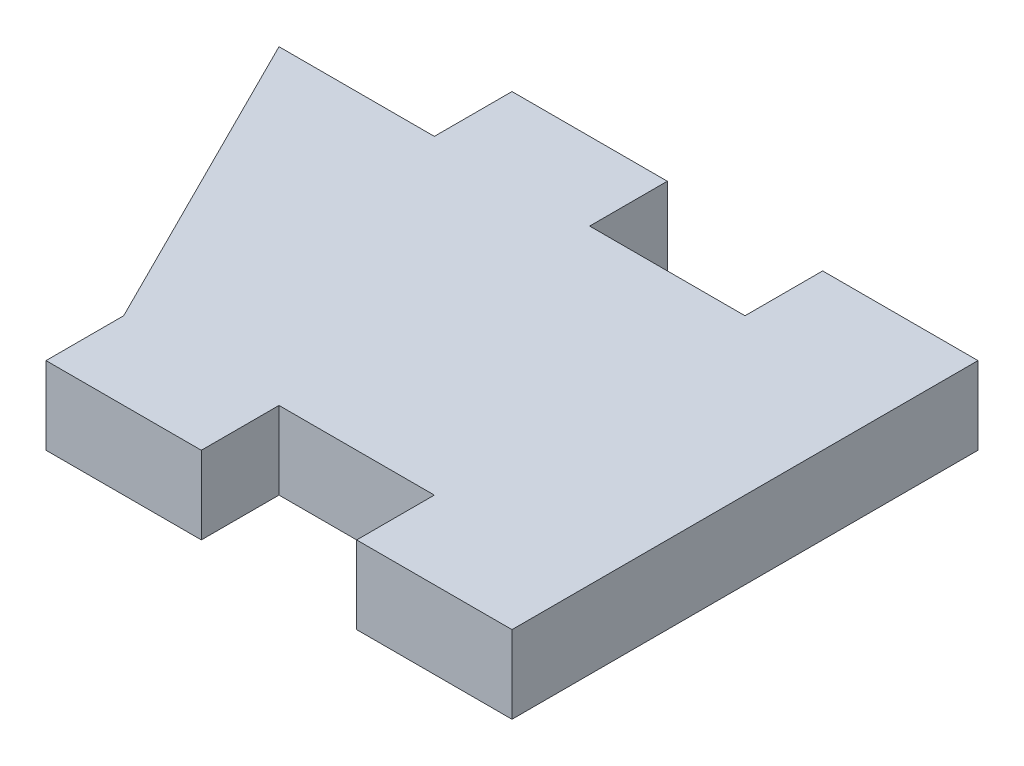
from build123d import *

# Parameters (mm, degrees)
SKETCH1_W           = 25.4
SKETCH1_H           = 12.7
BOSS_EXTRUDE1_DEPTH = 3.175
SKETCH2_W           = 6.35
SKETCH2_H           = 3.175
BOSS_EXTRUDE2_DEPTH = 3.175
CUT_EXTRUDE1_DEPTH  = 3.175


with BuildPart() as part:
    # Sketch1 → Boss-Extrude1 (new body)
    with BuildSketch(Plane(origin=(0, 0, 0), x_dir=(1, 0, 0), z_dir=(0, 1, 0))):
        Rectangle(SKETCH1_W, SKETCH1_H)
    extrude(amount=BOSS_EXTRUDE1_DEPTH)

    # Sketch2 → Boss-Extrude2 (add)
    with BuildSketch(Plane.XY.offset(6.35)):
        with Locations((9.525, 1.5875)):
            Rectangle(SKETCH2_W, SKETCH2_H)
        with Locations((-3.175, 1.5875)):
            Rectangle(SKETCH2_W, SKETCH2_H)
    boss_extrude2 = extrude(amount=BOSS_EXTRUDE2_DEPTH)

    # Mirror1: Boss-Extrude2 across plane
    add(boss_extrude2.mirror(Plane.XY))

    # Sketch3 → Cut-Extrude1 (cut)
    with BuildSketch(Plane(origin=(0, 3.175, 0), x_dir=(1, 0, 0), z_dir=(0, 1, 0))):
        Polygon((-6.35, -6.35), (-12.7, 6.35), (-12.7, -6.35), align=None)
    extrude(amount=-CUT_EXTRUDE1_DEPTH, mode=Mode.SUBTRACT)


solid = part.part
